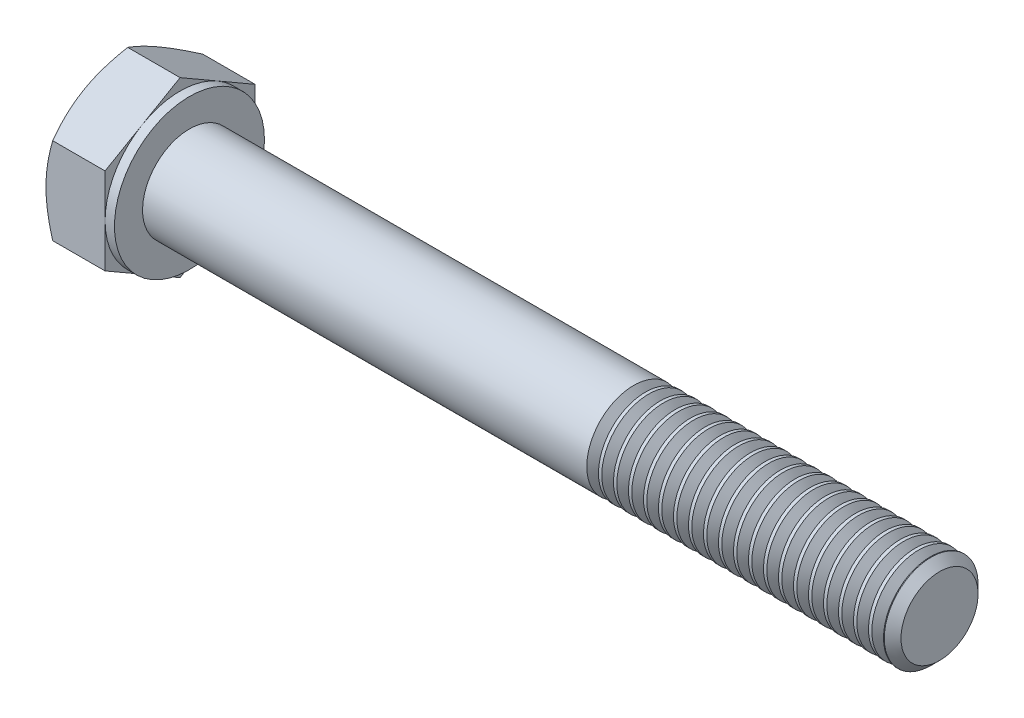
from build123d import *

# Parameters (mm, degrees)
BASEHEAD_DEPTH     = 3.65
INDENT_START       = -0.45625
INDENT_2_OUTLINE_R = 3.5
INDENT_2_DEPTH     = 0.45625
SKETCH4_W          = 0.5
SKETCH4_H          = 10.618802154
THDSCHPAT_COUNT    = 20
THDSCHPAT_PITCH    = 0.8


# Read off the part's stored shape, not the designer's step: Indent
with BuildPart() as part:
    # Sketch1 → BaseHead (new body)
    with BuildSketch(Plane(origin=(0, 0, 0), x_dir=(0, 0, -1), z_dir=(1, 0, 0))):
        Polygon((4, 2.309401077), (4, -2.309401077), (0, -4.618802154), (-4, -2.309401077), (-4, 2.309401077), (0, 4.618802154), align=None)
    extrude(amount=BASEHEAD_DEPTH)

    # Indent outline → Indent (revolve)
    with BuildSketch(Plane.YX):
        Polygon((2.5, 3.65), (2.5, 43.205), (2.055, 43.65), (0, 43.65), (0, 3.65), align=None)
    revolve(axis=Axis((0, 0, 0), (1, 0, 0)))

    # Indent 2 outline → Indent 2 (cut)
    with BuildSketch(Plane.ZY.offset(INDENT_START)):
        with Locations((0.033212245, 0.192376607)):
            Circle(INDENT_2_OUTLINE_R)
    extrude(amount=INDENT_2_DEPTH, mode=Mode.SUBTRACT)

    # Sketch3 → HeadChamfer (revolve, cut)
    with BuildSketch(Plane.XY, mode=Mode.PRIVATE) as headchamfer_sk:
        Polygon((0, 4), (3.244016936, 9.618802154), (3.244016936, 14.618802154), (-10, 14.618802154), (-10, 4), align=None)
    revolve(headchamfer_sk.sketch.rotate(Axis((0, 0, 0), (1, 0, 0)), 90), axis=Axis((0, 0, 0), (1, 0, 0)), mode=Mode.SUBTRACT)

    # Sketch4 → BearingFace (revolve, cut)
    with BuildSketch(Plane.XY, mode=Mode.PRIVATE) as bearingface_sk:
        with Locations((3.4, 9.309401077)):
            Rectangle(SKETCH4_W, SKETCH4_H)
    revolve(bearingface_sk.sketch.rotate(Axis((0, 0, 0), (1, 0, 0)), 90), axis=Axis((0, 0, 0), (1, 0, 0)), mode=Mode.SUBTRACT)

    # ThdSchSke → ThreadSchematic (revolve, cut)
    with BuildSketch(Plane.XY):
        Polygon((27.65, -2.055), (27.338407645, -2.5), (27.338407645, -3.125), (27.961592355, -3.125), (27.961592355, -2.5), align=None)
    threadschematic = revolve(axis=Axis((-3.175, 0, 0), (1, 0, 0)), mode=Mode.SUBTRACT)

    # ThdSchPat: ThreadSchematic ×20
    with Locations(*[(i * THDSCHPAT_PITCH, 0, 0) for i in range(1, THDSCHPAT_COUNT)]):
        add(threadschematic, mode=Mode.SUBTRACT)


solid = part.part
